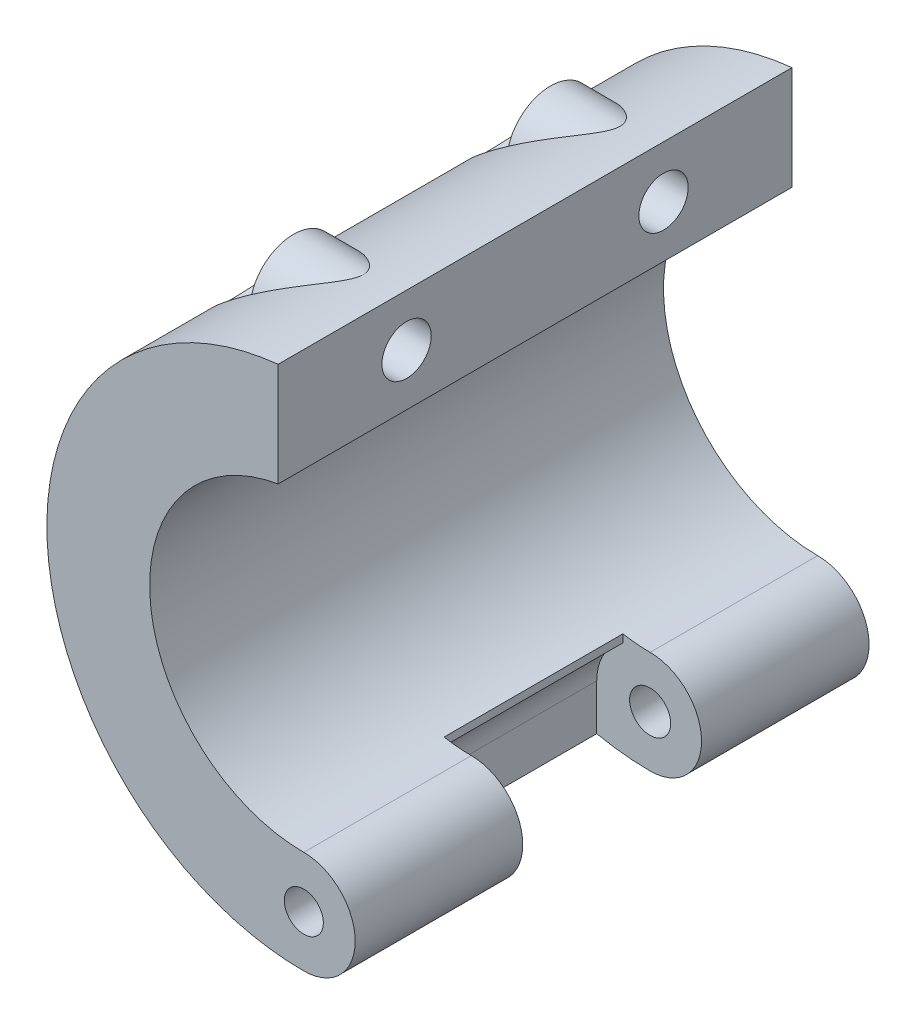
from build123d import *

# Parameters (mm, degrees)
SKETCH1_R              = 5
SKETCH1_R_2            = 3
BOSS_EXTRUDE1_DEPTH    = 50
CUT_EXTRUDE1_START     = 16.3
CUT_EXTRUDE1_OUTLINE_R = 3
CUT_EXTRUDE1_DEPTH     = 17.4
SKETCH2_W              = 5.2
SKETCH2_H              = 5
CUT_EXTRUDE2_DEPTH     = 17.4
CUT_EXTRUDE4_DEPTH     = 17.4
SKETCH3_R              = 4.25
BOSS_EXTRUDE2_DEPTH    = 11
SKETCH6_R              = 4.25
CUT_EXTRUDE5_DEPTH     = 59.883359407
HOLE1_D                = 4.8
HOLE1_CSINK_D          = 7.75
HOLE1_CSINK_ANGLE      = 82
SKETCH9_R              = 3
BOSS_EXTRUDE3_DEPTH    = 16.3
MIRROR1_START          = 33.7
MIRROR1_OUTLINE_R      = 3
MIRROR1_DEPTH          = 16.3
HOLE2_D                = 4
HOLE2_DEPTH            = 16.3
HOLE2_CSINK_D          = 7.75
HOLE2_CSINK_ANGLE      = 82
HOLE3_D                = 3.8


# Read off the part's stored shape, not the designer's step: Cut-Extrude1, Mirror1
with BuildPart() as part:
    # Sketch1 → Boss-Extrude1 (new body)
    # profile 1 of 2: a face of its own
    with BuildSketch(Plane.XY):
        with BuildLine():
            Line((-2.5, 14.790199458), (-2.5, 24.874685928))
            ThreePointArc((-2.5, 24.874685928), (-24.968651828, -1.251569376), (0, -25))
            ThreePointArc((0, -25), (-5, -20), (0, -15))
            ThreePointArc((0, -15), (-14.947457842, -1.254393904), (-2.5, 14.790199458))
        make_face()
    # profile 2 of 2: a face of its own
    with BuildSketch(Plane.XY):
        with Locations((0, -20)):
            Circle(SKETCH1_R)
        with Locations((0, -20)):
            Circle(SKETCH1_R_2, mode=Mode.SUBTRACT)
    extrude(amount=BOSS_EXTRUDE1_DEPTH)

    # Cut-Extrude1 outline → Cut-Extrude1 (cut)
    with BuildSketch(Plane.XY.offset(CUT_EXTRUDE1_START)):
        with BuildLine():
            ThreePointArc((-1.235879849, -14.949), (-5.196630355, -19.812829077), (-1.59605733, -24.949))
            ThreePointArc((-1.59605733, -24.949), (-0.798435971, -24.987246747), (0, -25))
            ThreePointArc((0, -25), (5, -20), (0, -15))
            ThreePointArc((0, -15), (-0.618465844, -14.987244577), (-1.235879849, -14.949))
        make_face()
        with Locations((0, -20)):
            Circle(CUT_EXTRUDE1_OUTLINE_R, mode=Mode.SUBTRACT)
    extrude(amount=CUT_EXTRUDE1_DEPTH, mode=Mode.SUBTRACT)

    # Sketch2 → Cut-Extrude2 (cut)
    with BuildSketch(Plane.XY.offset(16.3)):
        with Locations((-2.6, -22.5)):
            Rectangle(SKETCH2_W, SKETCH2_H)
    extrude(amount=CUT_EXTRUDE2_DEPTH, mode=Mode.SUBTRACT)

    # Sketch4 → Cut-Extrude4 (cut)
    with BuildSketch(Plane(origin=(0, 0, 33.7), x_dir=(-1, 0, 0), z_dir=(0, 0, -1))):
        with BuildLine():
            Line((2.655027114, -15.763157895), (2.655027114, -14.763157895))
            ThreePointArc((2.655027114, -14.763157895), (1.332784975, -14.940672147), (0, -15))
            ThreePointArc((0, -15), (1.381265629, -15.194575434), (2.655027114, -15.763157895))
        make_face()
    extrude(amount=CUT_EXTRUDE4_DEPTH, mode=Mode.SUBTRACT)

    # Sketch3 → Boss-Extrude2 (add)
    with BuildSketch(Plane(origin=(-2.5, 0, 0), x_dir=(0, 0, -1), z_dir=(1, 0, 0))):
        with Locations((-37.5, 19.832442693)):
            Circle(SKETCH3_R)
    extrude(amount=-BOSS_EXTRUDE2_DEPTH)

    # Sketch6 → Cut-Extrude5 (cut, through all)
    with BuildSketch(Plane.ZY.offset(13.5)):
        with Locations((37.5, 19.832442693)):
            Circle(SKETCH6_R)
    extrude(amount=CUT_EXTRUDE5_DEPTH, mode=Mode.SUBTRACT)

    # Hole1 (through all)
    with Locations(Plane(origin=(-13.5, 19.832442693, 37.5), x_dir=(0, 0, -1), z_dir=(-1, 0, 0))):
        with Locations((0, 0)):
            CounterSinkHole(HOLE1_D / 2, HOLE1_CSINK_D / 2, counter_sink_angle=HOLE1_CSINK_ANGLE)

    # Sketch9 → Boss-Extrude3 (add)
    with BuildSketch(Plane(origin=(0, 0, 0), x_dir=(-1, 0, 0), z_dir=(0, 0, -1))):
        with Locations(Location((0, -20, 0), (0, 0, 180))):
            Circle(SKETCH9_R)
    extrude(amount=-BOSS_EXTRUDE3_DEPTH)

    # Mirror1 outline → Mirror1 (add)
    with BuildSketch(Plane.XY.offset(MIRROR1_START)):
        with Locations((0, -20)):
            Circle(MIRROR1_OUTLINE_R)
    extrude(amount=MIRROR1_DEPTH)

    # Mirror1 2 outline → Mirror1 2 (revolve)
    with BuildSketch(Plane(origin=(0, 19.832442693, 12.5), x_dir=(0, 1, 0), z_dir=(0, 0, -1))):
        Polygon((2.4, -11.803206599), (3.875, -13.5), (4.25, -13.5), (4.25, -6.708985665), (2.4, -6.708985665), align=None)
    revolve(axis=Axis((0, 19.832442693, 12.5), (1, 0, 0)))

    # Mirror1 3 outline → Mirror1 3 (revolve, cut)
    with BuildSketch(Plane(origin=(0, 19.832442693, 12.5), x_dir=(0, 1, 0), z_dir=(0, 0, -1))):
        Polygon((4.25, -13.5), (3.875, -13.5), (2.4, -11.803206599), (2.4, -2.5), (0, -2.5), (0, -19.550181267), (4.25, -19.550181267), align=None)
    revolve(axis=Axis((0, 19.832442693, 12.5), (1, 0, 0)), mode=Mode.SUBTRACT)

    # Hole2
    with Locations(Plane(origin=(0, -20, 0), x_dir=(-1, 0, 0), z_dir=(0, 0, -1))):
        with Locations((0, 0)):
            CounterSinkHole(HOLE2_D / 2, HOLE2_CSINK_D / 2, depth=HOLE2_DEPTH, counter_sink_angle=HOLE2_CSINK_ANGLE)

    # Hole3 (through all)
    with Locations(Plane(origin=(0, -20, 33.7), x_dir=(-1, 0, 0), z_dir=(0, 0, -1))):
        with Locations((0, 0)):
            Hole(HOLE3_D / 2)


solid = part.part
